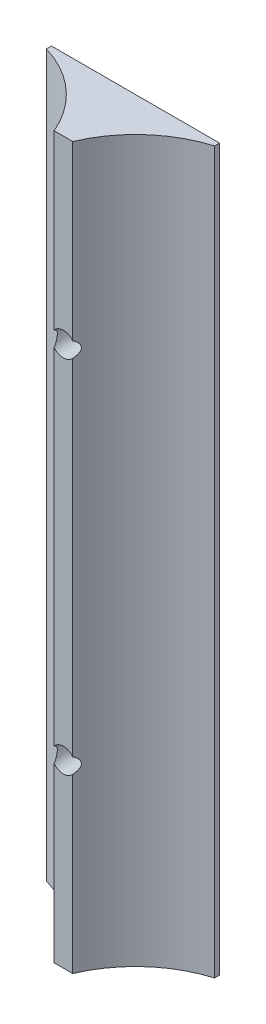
from build123d import *

# Parameters (mm, degrees)
BOSS_EXTRUDE1_DEPTH                       = 60
TAPPED_HOLE_FOR_M2_5X0_45_HELICOIL1_D     = 2.55
TAPPED_HOLE_FOR_M2_5X0_45_HELICOIL1_DEPTH = 4
TAPPED_HOLE_FOR_M2_5X0_45_HELICOIL1_TIP   = 0.766097289
F_2_0MM_DOWEL_HOLE1_D                     = 2
F_2_0MM_DOWEL_HOLE1_DEPTH                 = 6.45
F_2_0MM_DOWEL_HOLE1_TIP                   = 0.600860619


with BuildPart() as part:
    # Sketch1 → Boss-Extrude1 (new body)
    with BuildSketch(Plane(origin=(0, 0, 0), x_dir=(1, 0, 0), z_dir=(0, 1, 0))):
        with BuildLine():
            Line((-0.775138123, 0), (0.775138123, 0))
            ThreePointArc((0.775138123, 0), (3.263641579, 3.487947468), (7, 5.585100956))
            Line((7, 5.585100956), (7, 6))
            Line((7, 6), (-7, 6))
            Line((-7, 6), (-7, 5.585100956))
            ThreePointArc((-7, 5.585100956), (-3.263641579, 3.487947468), (-0.775138123, 0))
        make_face()
    extrude(amount=BOSS_EXTRUDE1_DEPTH)

    # Tapped Hole for M2.5x0.45 Helicoil1
    with Locations(Plane(origin=(0, 45, -6), x_dir=(-1, 0, 0), z_dir=(0, 0, -1))):
        with Locations((0, 0), (0, -30)):
            Hole(TAPPED_HOLE_FOR_M2_5X0_45_HELICOIL1_D / 2, depth=TAPPED_HOLE_FOR_M2_5X0_45_HELICOIL1_DEPTH)
            with Locations((0, 0, -(TAPPED_HOLE_FOR_M2_5X0_45_HELICOIL1_DEPTH + TAPPED_HOLE_FOR_M2_5X0_45_HELICOIL1_TIP / 2))):  # 118° drill point
                Cone(0, TAPPED_HOLE_FOR_M2_5X0_45_HELICOIL1_D / 2, TAPPED_HOLE_FOR_M2_5X0_45_HELICOIL1_TIP, mode=Mode.SUBTRACT)

    # Ø2.0mm Dowel Hole1
    with Locations(Plane(origin=(0, 45, -6), x_dir=(-1, 0, 0), z_dir=(0, 0, -1))):
        with Locations((0, 0), (0, -30)):
            Hole(F_2_0MM_DOWEL_HOLE1_D / 2, depth=F_2_0MM_DOWEL_HOLE1_DEPTH)
            with Locations((0, 0, -(F_2_0MM_DOWEL_HOLE1_DEPTH + F_2_0MM_DOWEL_HOLE1_TIP / 2))):  # 118° drill point
                Cone(0, F_2_0MM_DOWEL_HOLE1_D / 2, F_2_0MM_DOWEL_HOLE1_TIP, mode=Mode.SUBTRACT)


solid = part.part
